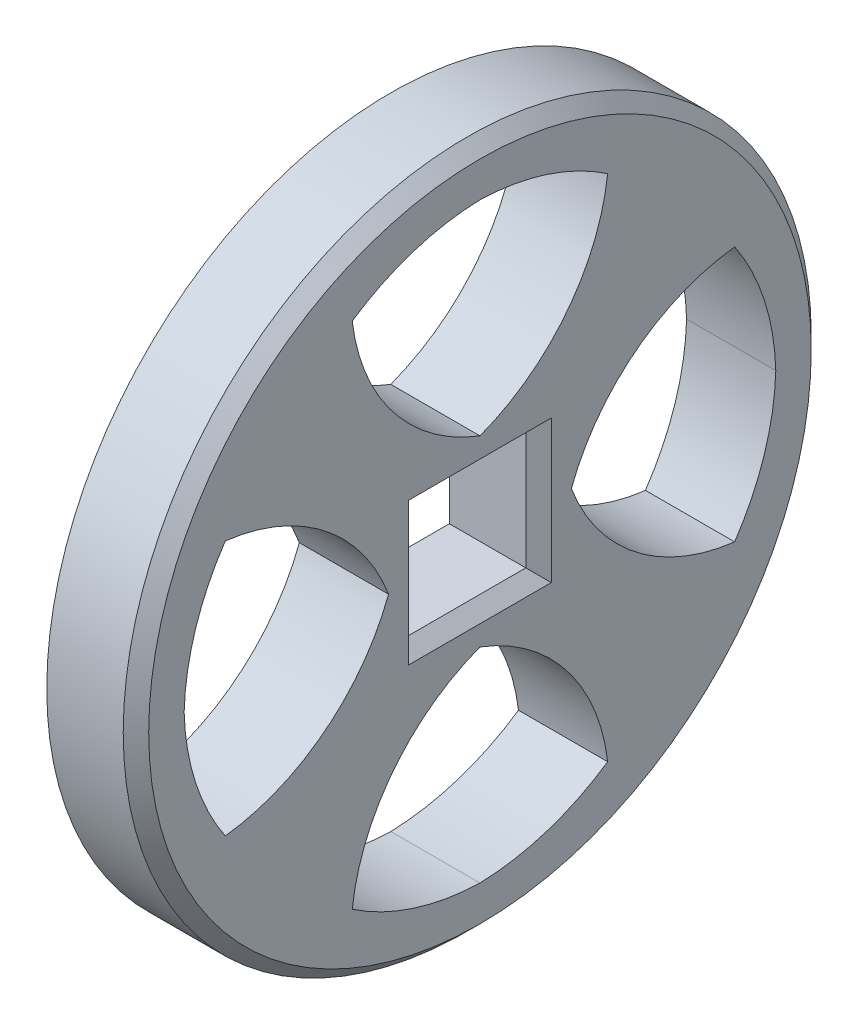
from build123d import *

# Parameters (mm, degrees)
SKETCH1_R           = 13.5
BOSS_EXTRUDE1_DEPTH = 3.5
CUT_EXTRUDE1_REACH  = 21.41
CIRPATTERN1_COUNT   = 4
CUT_EXTRUDE2_REACH  = 21.41
SKETCH3_W           = 4.596194078
SKETCH3_H           = 4.596194078
CHAMFER1_SIZE       = 0.5


with BuildPart() as part:
    # Sketch1 → Boss-Extrude1 (new body)
    with BuildSketch(Plane(origin=(0, 0, 0), x_dir=(0, 0, -1), z_dir=(1, 0, 0))):
        Circle(SKETCH1_R)
    extrude(amount=BOSS_EXTRUDE1_DEPTH)

    # Sketch2 → Cut-Extrude1 (cut, up to next)
    with BuildSketch(Plane(origin=(0, 0, 0), x_dir=(0, 0, -1), z_dir=(1, 0, 0)), mode=Mode.PRIVATE) as cut_extrude1_sk1:
        with BuildLine():
            ThreePointArc((0, 3.587478321), (-3.402339743, 6.089548883), (-5.012219469, 9.99397715))
            ThreePointArc((-5.012219469, 9.99397715), (-2.621563936, 11.159720287), (0, 11.6087119))
            ThreePointArc((0, 11.6087119), (2.621563936, 11.159720287), (5.012219469, 9.99397715))
            ThreePointArc((5.012219469, 9.99397715), (3.402339743, 6.089548883), (0, 3.587478321))
        make_face()
    cut_extrude1_tool1 = extrude(cut_extrude1_sk1.sketch, amount=CUT_EXTRUDE1_REACH, mode=Mode.PRIVATE) & part.part
    cut_extrude1 = cut_extrude1_tool1.solids().sort_by_distance((0, 8.091595, 0))[0]
    add(cut_extrude1, mode=Mode.SUBTRACT)

    # CirPattern1: Cut-Extrude1 ×4 about axis
    cirpattern1_axis = Axis((3.5, 0, 0), (-1, 0, 0))
    for i in range(1, CIRPATTERN1_COUNT):
        add(cut_extrude1.rotate(cirpattern1_axis, i * 360 / CIRPATTERN1_COUNT), mode=Mode.SUBTRACT)

    # Sketch3 → Cut-Extrude2 (cut, up to next)
    with BuildSketch(Plane(origin=(0, 0, 0), x_dir=(0, 0, -1), z_dir=(1, 0, 0)), mode=Mode.PRIVATE) as cut_extrude2_sk1:
        Rectangle(SKETCH3_W, SKETCH3_H)
    cut_extrude2_tool1 = extrude(cut_extrude2_sk1.sketch, amount=CUT_EXTRUDE2_REACH, mode=Mode.PRIVATE) & part.part
    add(cut_extrude2_tool1.solids().sort_by_distance((0, 0, 0))[0], mode=Mode.SUBTRACT)

    # Chamfer1
    chamfer1_edges = [part.edges().sort_by_distance(p)[0] for p in [
        (3.5, 0, 2.298097039),
        (3.5, -2.298097039, 0),
        (3.5, 2.298097039, 0),
        (3.5, 0, -2.298097039),
        (3.5, 0, 13.5),
    ]]
    chamfer(chamfer1_edges, length=CHAMFER1_SIZE)


solid = part.part
